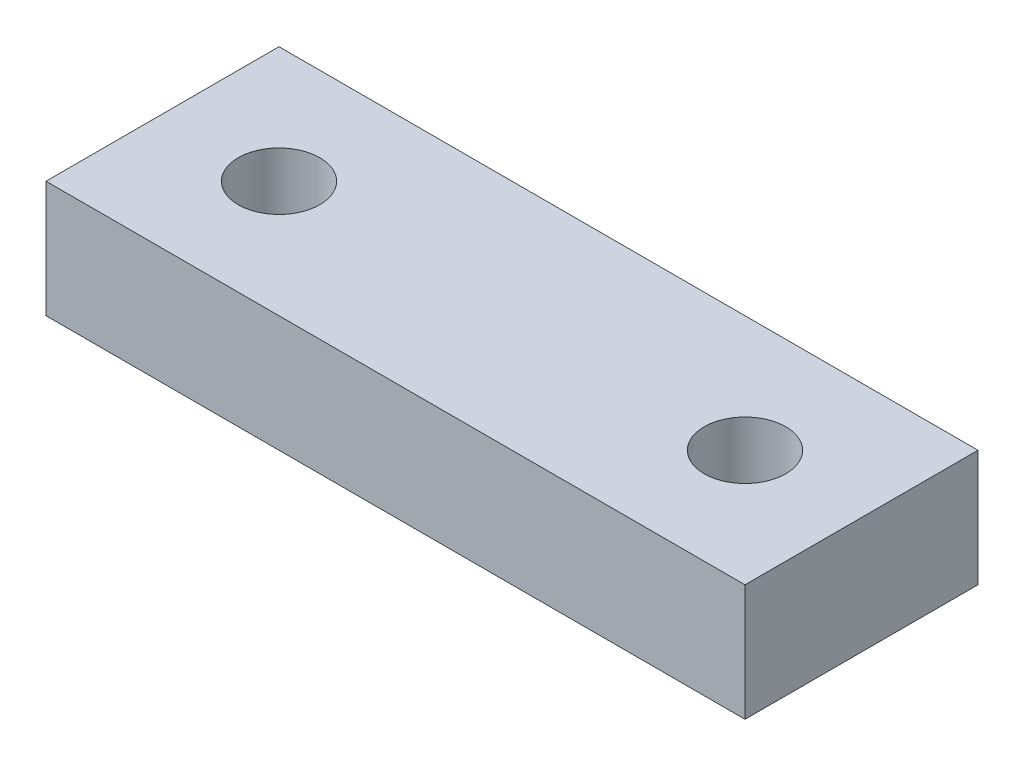
from build123d import *

# Parameters (mm, degrees)
SCHIZZO1_W                   = 30
SCHIZZO1_H                   = 5
ESTRUSIONE_ESTRUSIONE1_DEPTH = 10
FORO_3_5_3_5_1_D             = 3.5


with BuildPart() as part:
    # Schizzo1 → Estrusione-Estrusione1 (new body)
    with BuildSketch(Plane.XY):
        with Locations((0, 2.5)):
            Rectangle(SCHIZZO1_W, SCHIZZO1_H)
    extrude(amount=ESTRUSIONE_ESTRUSIONE1_DEPTH)

    # Foro Ø3.5 (3.5)-1 (through all)
    with Locations(Plane(origin=(0, 5, 0), x_dir=(1, 0, 0), z_dir=(0, 1, 0))):
        with Locations((-10, -5), (10, -5)):
            Hole(FORO_3_5_3_5_1_D / 2)


solid = part.part
